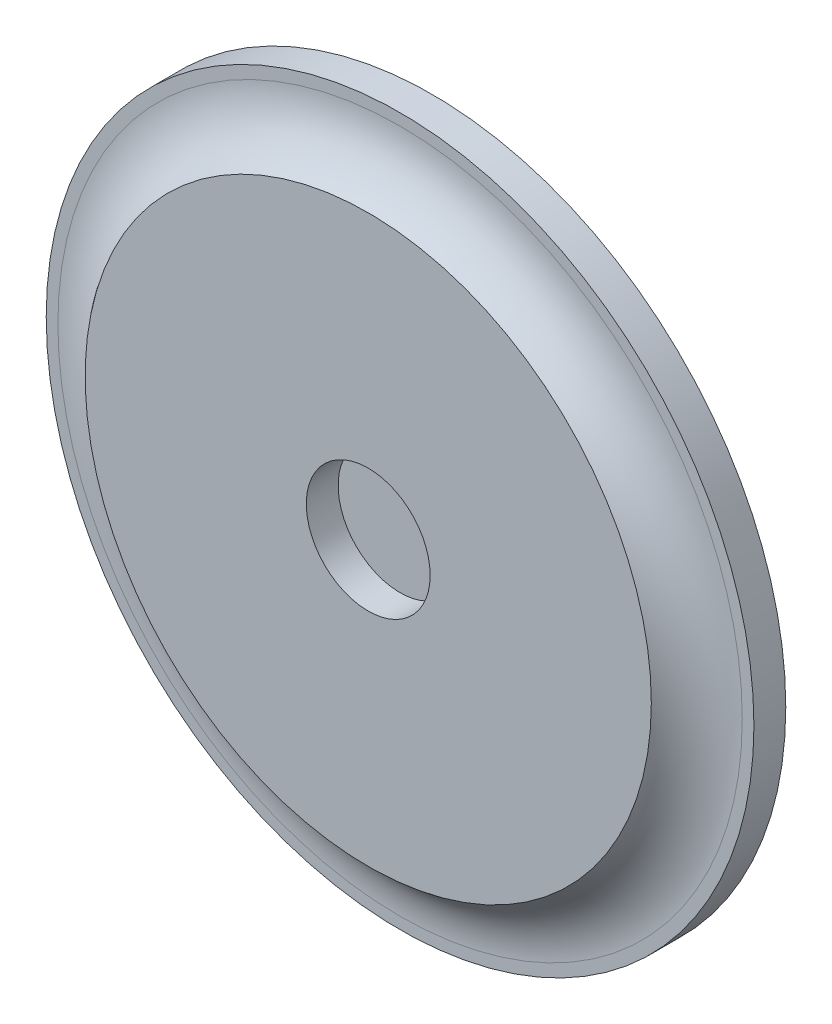
from build123d import *

# Parameters (mm, degrees)
SKETCH1_R           = 10
BOSS_EXTRUDE1_DEPTH = 1.8
CUT_EXTRUDE1_START  = -0.9
SKETCH2_R           = 10
SKETCH2_R_2         = 8
CUT_EXTRUDE1_DEPTH  = 0.9
FILLET2_R           = 2
SKETCH3_R           = 1.75
CUT_EXTRUDE2_DEPTH  = 0.9


with BuildPart() as part:
    # Sketch1 → Boss-Extrude1 (new body)
    with BuildSketch(Plane(origin=(0, 0, 0), x_dir=(0, 1, 0), z_dir=(0, 0, 1))):
        with Locations(Location((0, 0, 0), (0, 0, 270))):
            Circle(SKETCH1_R)
    extrude(amount=BOSS_EXTRUDE1_DEPTH)

    # Sketch2 → Cut-Extrude1 (cut)
    with BuildSketch(Plane.XY.offset(1.8).offset(CUT_EXTRUDE1_START)):
        Circle(SKETCH2_R)
        Circle(SKETCH2_R_2, mode=Mode.SUBTRACT)
    extrude(amount=CUT_EXTRUDE1_DEPTH, mode=Mode.SUBTRACT)

    # Fillet2
    # the kernel refuses this fillet: 2 mm, written as the material it adds along each edge
    with BuildSketch(Plane(origin=(0, 0, 0.9), x_dir=(1, 0, 0), z_dir=(0, -1, 0))) as fillet2_piece_1:
        with BuildLine():
            CenterArc((9.670329309, 2), FILLET2_R, 213.367012969, 56.632987031)
            Line((8, 0.9), (7.966593414, 0.878))
            ThreePointArc((7.966593414, 0.878), (7.96, 0.45), (7.96, 0))
            Line((7.96, 0), (8, -0.04))
            Line((8, -0.04), (9.670329309, -0.04))
            Line((9.670329309, -0.04), (9.670329309, 0))
        make_face()
    revolve(axis=Axis((0, 0, 0.9), (0, 0, 1)))

    # Sketch3 → Cut-Extrude2 (cut)
    with BuildSketch(Plane.XY.offset(1.8)):
        Circle(SKETCH3_R)
    extrude(amount=-CUT_EXTRUDE2_DEPTH, mode=Mode.SUBTRACT)


solid = part.part
